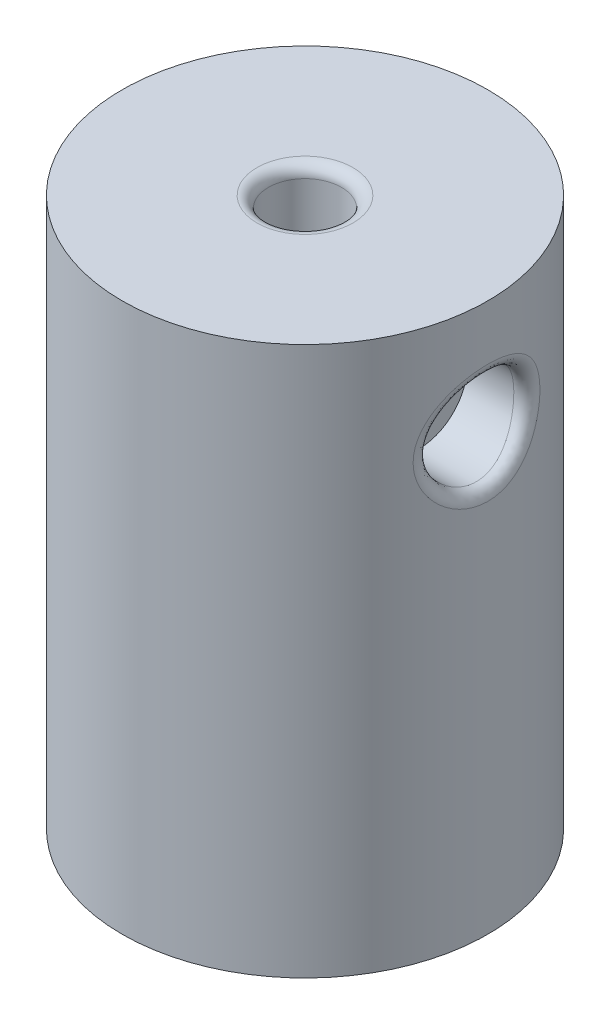
from build123d import *

# Parameters (mm, degrees)
SKETCH1_R           = 8
BOSS_EXTRUDE1_DEPTH = 24
SKETCH2_R           = 1.6
CUT_EXTRUDE1_DEPTH  = 12
CUT_EXTRUDE2_START  = 1.287439
SKETCH3_R           = 0.95
CUT_EXTRUDE2_DEPTH  = 6.712561
CUT_EXTRUDE3_START  = 5
SKETCH4_R           = 2.1
CUT_EXTRUDE3_DEPTH  = 10
FILLET1_R           = 0.5


with BuildPart() as part:
    # Sketch1 → Boss-Extrude1 (new body)
    with BuildSketch(Plane(origin=(0, 0, 0), x_dir=(1, 0, 0), z_dir=(0, 1, 0))):
        with Locations(Location((0, 0, 0), (0, 0, 270))):
            Circle(SKETCH1_R)
    extrude(amount=BOSS_EXTRUDE1_DEPTH)

    # Sketch2 → Cut-Extrude1 (cut)
    with BuildSketch(Plane(origin=(0, 24, 0), x_dir=(1, 0, 0), z_dir=(0, 1, 0))):
        with Locations(Location((0, 0, 0), (0, 0, 270))):
            Circle(SKETCH2_R)
    extrude(amount=-CUT_EXTRUDE1_DEPTH, mode=Mode.SUBTRACT)

    # Sketch3 → Cut-Extrude2 (cut)
    with BuildSketch(Plane(origin=(0, 0, 0), x_dir=(0, 0, -1), z_dir=(1, 0, 0)).offset(CUT_EXTRUDE2_START)):
        with Locations((0, 19)):
            Circle(SKETCH3_R)
    extrude(amount=CUT_EXTRUDE2_DEPTH, mode=Mode.SUBTRACT)

    # Sketch4 → Cut-Extrude3 (cut)
    with BuildSketch(Plane(origin=(0, 0, 0), x_dir=(0, 0, -1), z_dir=(1, 0, 0)).offset(CUT_EXTRUDE3_START)):
        with Locations(Location((0, 19, 0), (0, 0, 180))):
            Circle(SKETCH4_R)
    extrude(amount=CUT_EXTRUDE3_DEPTH, mode=Mode.SUBTRACT)

    # Fillet1
    fillet1_edges = [part.edges().sort_by_distance(p)[0] for p in [
        (7.719455941, 19.000000003, -2.100000016),
        (5, 19, 0.95),
        (0, 24, -1.6),
    ]]
    fillet(fillet1_edges, radius=FILLET1_R)


solid = part.part
